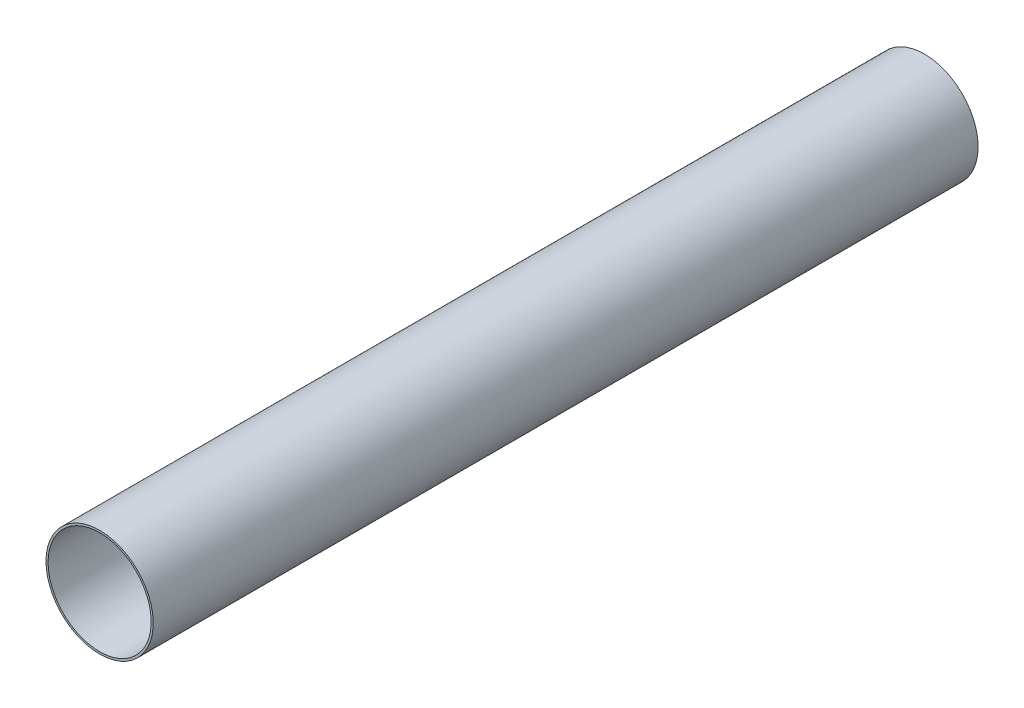
from build123d import *

# Parameters (mm, degrees)
SKETCH1_R           = 39.624
SKETCH1_R_2         = 38.1
BOSS_EXTRUDE1_DEPTH = 609.6


with BuildPart() as part:
    # Sketch1 → Boss-Extrude1 (new body)
    with BuildSketch(Plane.XY):
        Circle(SKETCH1_R)
        Circle(SKETCH1_R_2, mode=Mode.SUBTRACT)
    extrude(amount=BOSS_EXTRUDE1_DEPTH)


solid = part.part
